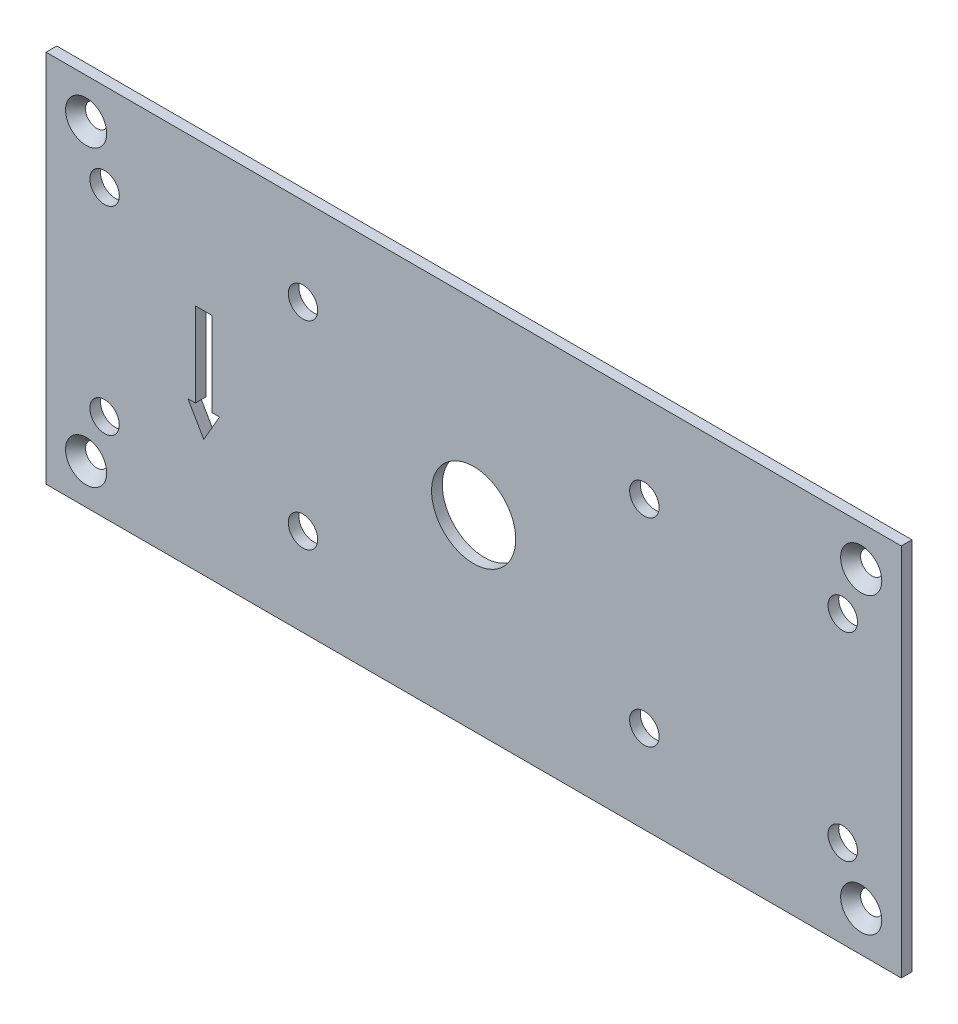
from build123d import *

# Parameters (mm, degrees)
SKETCH2_W                                    = 203.2
SKETCH2_H                                    = 88.9
SKETCH2_R                                    = 3.5
SKETCH2_R_2                                  = 10
BOSS_EXTRUDE1_DEPTH                          = 1.27
SKETCH3_R                                    = 2.5527
CUT_EXTRUDE1_DEPTH                           = 111.92706658
CUT_EXTRUDE2_DEPTH                           = 111.92706658
CUT_EXTRUDE2_DEPTH_BACK                      = 111.92706658
CSK_FOR_10_OVAL_HEAD_MACHINE_SCREW1_AT_COUNT = 2
CSK_FOR_10_OVAL_HEAD_MACHINE_SCREW1_AT_PITCH = 69.85
CSK_FOR_10_OVAL_HEAD_MACHINE_SCREW1_2_COUNT  = 2
CSK_FOR_10_OVAL_HEAD_MACHINE_SCREW1_2_PITCH  = 196.952392725
CSK_FOR_10_OVAL_HEAD_MACHINE_SCREW1_3_COUNT  = 2
CSK_FOR_10_OVAL_HEAD_MACHINE_SCREW1_3_PITCH  = 184.15


with BuildPart() as part:
    # Sketch2 → Boss-Extrude1 (new, symmetric)
    with BuildSketch(Plane.XY):
        Rectangle(SKETCH2_W, SKETCH2_H)
        with Locations((-87.695, 23.57)):
            Circle(SKETCH2_R, mode=Mode.SUBTRACT)
        with Locations((-40.555, 23.57)):
            Circle(SKETCH2_R, mode=Mode.SUBTRACT)
        with Locations((-40.555, -23.57)):
            Circle(SKETCH2_R, mode=Mode.SUBTRACT)
        with Locations((-87.695, -23.57)):
            Circle(SKETCH2_R, mode=Mode.SUBTRACT)
        with Locations((40.555, -23.57)):
            Circle(SKETCH2_R, mode=Mode.SUBTRACT)
        with Locations((87.695, -23.57)):
            Circle(SKETCH2_R, mode=Mode.SUBTRACT)
        with Locations((87.695, 23.57)):
            Circle(SKETCH2_R, mode=Mode.SUBTRACT)
        with Locations((40.555, 23.57)):
            Circle(SKETCH2_R, mode=Mode.SUBTRACT)
        Circle(SKETCH2_R_2, mode=Mode.SUBTRACT)
    extrude(amount=BOSS_EXTRUDE1_DEPTH, both=True)

    # Sketch3 → Cut-Extrude1 (cut, through all)
    with BuildSketch(Plane.XY.offset(1.27)):
        with Locations((-92.075, 34.925)):
            Circle(SKETCH3_R)
        with Locations((-92.075, -34.925)):
            Circle(SKETCH3_R)
        with Locations((92.075, -34.925)):
            Circle(SKETCH3_R)
        with Locations((92.075, 34.925)):
            Circle(SKETCH3_R)
    extrude(amount=-CUT_EXTRUDE1_DEPTH, mode=Mode.SUBTRACT)

    # Sketch4 → Cut-Extrude2 (cut, two sides: drawn at the far end of the back side and taken through both)
    with BuildSketch(Plane.XY.offset(1.27).offset(-CUT_EXTRUDE2_DEPTH_BACK)):
        Polygon((-60.375348502, -10), (-62.125, -10), (-62.125, 10), (-66.125, 10), (-66.125, -10), (-67.874651498, -10), (-64.125, -16.494586906), align=None)
    extrude(amount=CUT_EXTRUDE2_DEPTH + CUT_EXTRUDE2_DEPTH_BACK, mode=Mode.SUBTRACT)

    # Sketch6 → CSK for #10 Oval Head Machine Screw1 (revolve, cut)
    with BuildSketch(Plane(origin=(-92.075, 34.925, 1.27), x_dir=(0, -1, 0), z_dir=(1, 0, 0))):
        Polygon((0, 0), (0, 2.54), (2.5527, 2.54), (2.5527, 2.688180894), (4.8895, 0), align=None)
    csk_for_10_oval_head_machine_screw1 = revolve(axis=Axis((-92.075, 34.925, 7.62), (0, 0, -1)), mode=Mode.SUBTRACT)

    # CSK for #10 Oval Head Machine Screw1 at: CSK for #10 Oval Head Machine Screw1 ×2
    with Locations(*[(0, -i * CSK_FOR_10_OVAL_HEAD_MACHINE_SCREW1_AT_PITCH, 0) for i in range(1, CSK_FOR_10_OVAL_HEAD_MACHINE_SCREW1_AT_COUNT)]):
        add(csk_for_10_oval_head_machine_screw1, mode=Mode.SUBTRACT)

    # CSK for _10 Oval Head Machine Screw1 2: CSK for #10 Oval Head Machine Screw1 ×2
    with Locations(*[Vector(0.9349975263177835, -0.35465423412053854, 0) * (i * CSK_FOR_10_OVAL_HEAD_MACHINE_SCREW1_2_PITCH) for i in range(1, CSK_FOR_10_OVAL_HEAD_MACHINE_SCREW1_2_COUNT)]):
        add(csk_for_10_oval_head_machine_screw1, mode=Mode.SUBTRACT)

    # CSK for _10 Oval Head Machine Screw1 3: CSK for #10 Oval Head Machine Screw1 ×2
    with Locations(*[(i * CSK_FOR_10_OVAL_HEAD_MACHINE_SCREW1_3_PITCH, 0, 0) for i in range(1, CSK_FOR_10_OVAL_HEAD_MACHINE_SCREW1_3_COUNT)]):
        add(csk_for_10_oval_head_machine_screw1, mode=Mode.SUBTRACT)


solid = part.part
